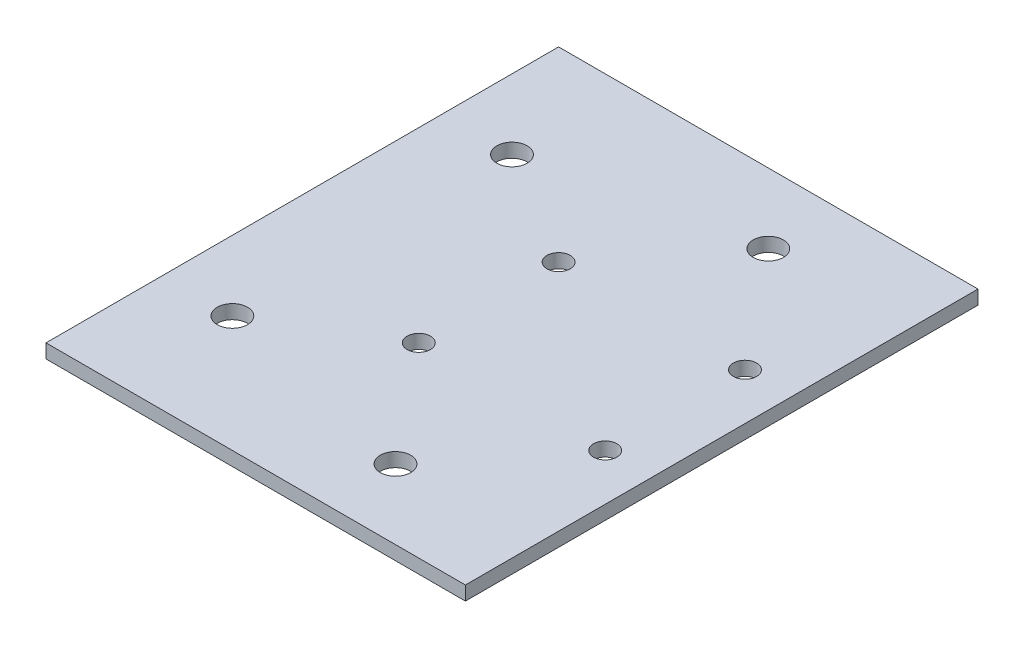
from build123d import *

# Parameters (mm, degrees)
SKETCH1_W           = 90
SKETCH1_H           = 110
SKETCH1_R           = 3.25
SKETCH1_R_2         = 2.5
BOSS_EXTRUDE1_DEPTH = 3


with BuildPart() as part:
    # Sketch1 → Boss-Extrude1 (new body)
    with BuildSketch(Plane(origin=(0, 0, 0), x_dir=(1, 0, 0), z_dir=(0, 1, 0))):
        Rectangle(SKETCH1_W, SKETCH1_H)
        with Locations((-30, 30)):
            Circle(SKETCH1_R, mode=Mode.SUBTRACT)
        with Locations((-30, -30)):
            Circle(SKETCH1_R, mode=Mode.SUBTRACT)
        with Locations((-5, 15)):
            Circle(SKETCH1_R_2, mode=Mode.SUBTRACT)
        with Locations((35, 15)):
            Circle(SKETCH1_R_2, mode=Mode.SUBTRACT)
        with Locations((35, -15)):
            Circle(SKETCH1_R_2, mode=Mode.SUBTRACT)
        with Locations((-5, -15)):
            Circle(SKETCH1_R_2, mode=Mode.SUBTRACT)
        with Locations((15, -40)):
            Circle(SKETCH1_R, mode=Mode.SUBTRACT)
        with Locations((15, 40)):
            Circle(SKETCH1_R, mode=Mode.SUBTRACT)
    extrude(amount=BOSS_EXTRUDE1_DEPTH)


solid = part.part
